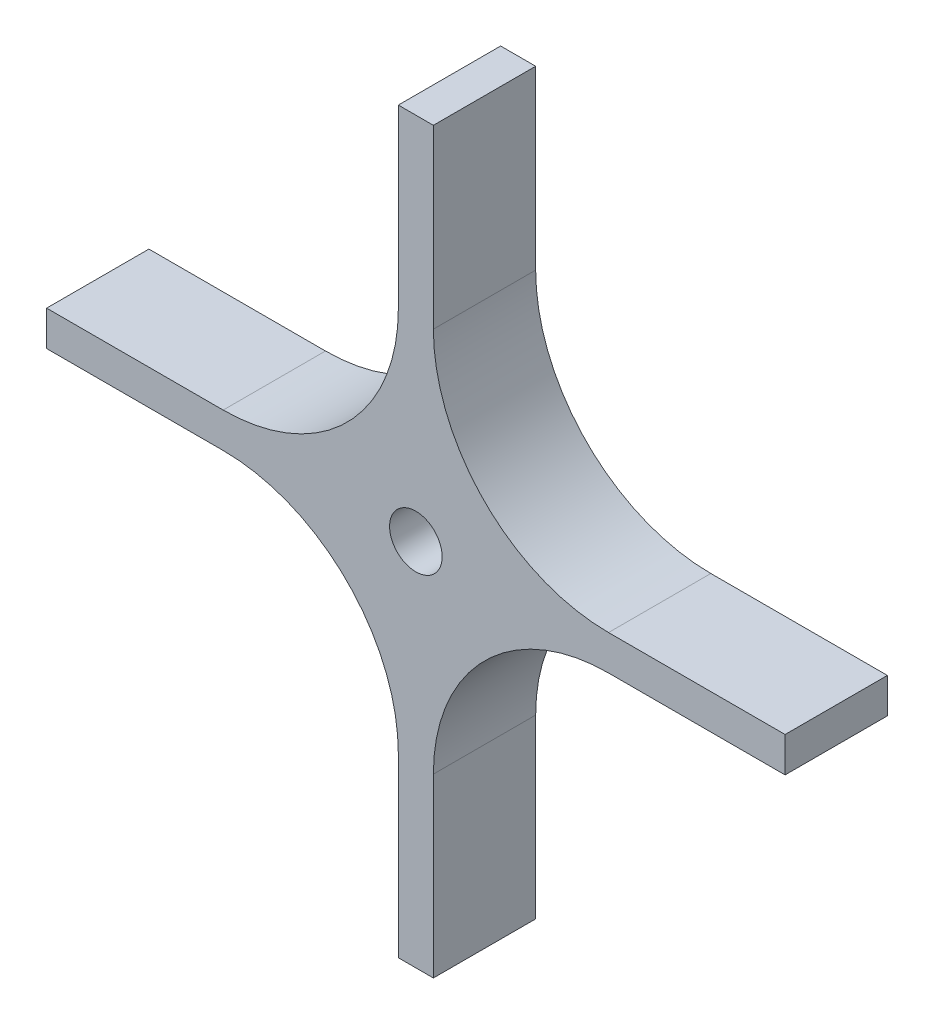
from build123d import *

# Parameters (mm, degrees)
BOSS_EXTRUDE1_DEPTH            = 4.6355
FILLET1_R                      = 15.875
F_3_16_0_1875_DIAMETER_HOLE1_D = 4.7625


with BuildPart() as part:
    # Sketch1 → Boss-Extrude1 (new, symmetric)
    with BuildSketch(Plane.XY):
        Polygon((1.5875, -1.5875), (1.5875, -33.4645), (-1.5875, -33.4645), (-1.5875, -1.5875), (-33.4645, -1.5875), (-33.4645, 1.5875), (-1.5875, 1.5875), (-1.5875, 33.4645), (1.5875, 33.4645), (1.5875, 1.5875), (33.4645, 1.5875), (33.4645, -1.5875), align=None)
    extrude(amount=BOSS_EXTRUDE1_DEPTH, both=True)

    # Fillet1
    fillet1_edges = [part.edges().sort_by_distance(p)[0] for p in [
        (-1.5875, -1.5875, 0),
        (-1.5875, 1.5875, 0),
        (1.5875, -1.5875, 0),
        (1.5875, 1.5875, 0),
    ]]
    fillet(fillet1_edges, radius=FILLET1_R)

    # 3/16 (0.1875) Diameter Hole1 (through all)
    with Locations(Plane.XY.offset(4.6355)):
        with Locations((0, 0)):
            Hole(F_3_16_0_1875_DIAMETER_HOLE1_D / 2)


solid = part.part
